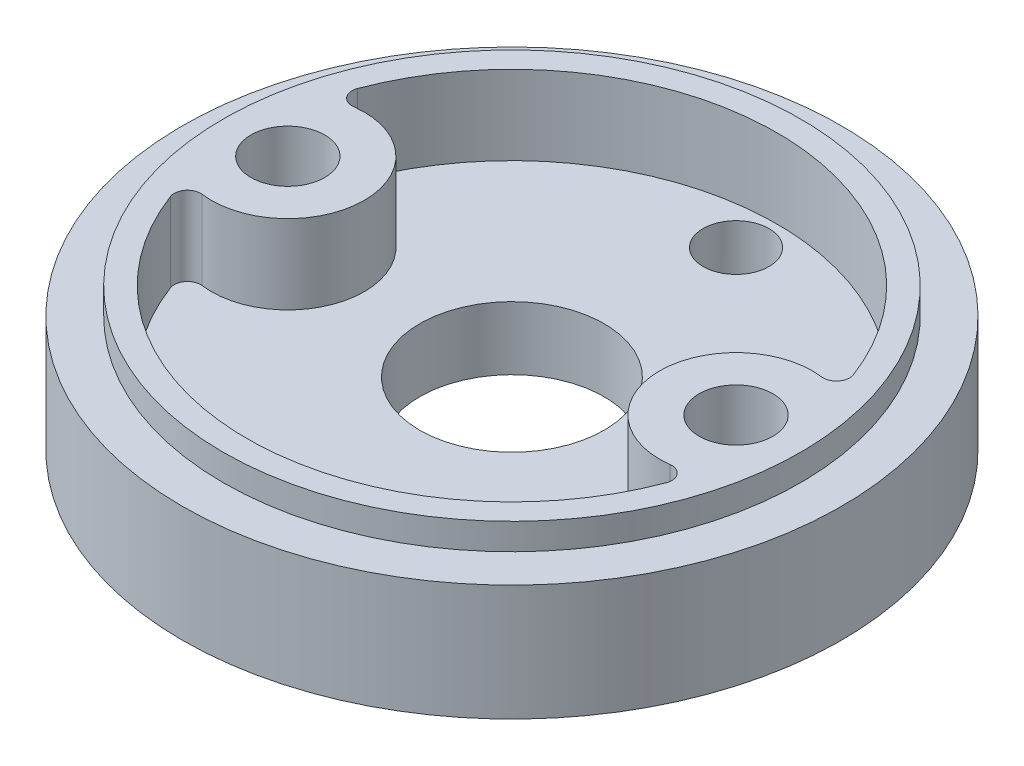
from build123d import *

# Parameters (mm, degrees)
SKETCH1_R             = 12.5
BOSS_EXTRUDE1_DEPTH   = 4.4
SKETCH2_R             = 10.95
BOSS_EXTRUDE2_DEPTH   = 1
SKETCH3_R             = 10.05
CUT_EXTRUDE1_DEPTH    = 3
SKETCH4_R             = 3.5
CUT_EXTRUDE2_DEPTH    = 18.930421077
SKETCH5_R             = 1.4
CUT_EXTRUDE3_DEPTH    = 19.484047176
SKETCH6_R             = 1.4
BOSS_EXTRUDE3_DEPTH   = 3
FILLET1_R             = 0.5
SKETCH7_R             = 2.5
CUT_EXTRUDE4_DEPTH    = 2.65
M3X0_5_TAPPED_HOLE1_D = 2.5


with BuildPart() as part:
    # Sketch1 → Boss-Extrude1 (new body)
    with BuildSketch(Plane(origin=(0, 0, 0), x_dir=(1, 0, 0), z_dir=(0, 1, 0))):
        with Locations(Location((0, 0, 0), (0, 0, 270))):
            Circle(SKETCH1_R)
    extrude(amount=BOSS_EXTRUDE1_DEPTH)

    # Sketch2 → Boss-Extrude2 (add)
    with BuildSketch(Plane(origin=(0, 4.4, 0), x_dir=(1, 0, 0), z_dir=(0, 1, 0))):
        with Locations(Location((0, 0, 0), (0, 0, 270))):
            Circle(SKETCH2_R)
    extrude(amount=BOSS_EXTRUDE2_DEPTH)

    # Sketch3 → Cut-Extrude1 (cut)
    with BuildSketch(Plane(origin=(0, 5.4, 0), x_dir=(1, 0, 0), z_dir=(0, 1, 0))):
        with Locations(Location((0, 0, 0), (0, 0, 270))):
            Circle(SKETCH3_R)
    extrude(amount=-CUT_EXTRUDE1_DEPTH, mode=Mode.SUBTRACT)

    # Sketch4 → Cut-Extrude2 (cut, through all)
    with BuildSketch(Plane(origin=(0, 2.4, 0), x_dir=(1, 0, 0), z_dir=(0, 1, 0))):
        with Locations(Location((0, 0, 0), (0, 0, 270))):
            Circle(SKETCH4_R)
    extrude(amount=-CUT_EXTRUDE2_DEPTH, mode=Mode.SUBTRACT)

    # Sketch5 → Cut-Extrude3 (cut, through all)
    with BuildSketch(Plane.XZ):
        with Locations(Location((-8.5, 0, 0), (0, 0, 270))):
            Circle(SKETCH5_R)
        with Locations(Location((8.5, 0, 0), (0, 0, 270))):
            Circle(SKETCH5_R)
    extrude(amount=-CUT_EXTRUDE3_DEPTH, mode=Mode.SUBTRACT)

    # Sketch6 → Boss-Extrude3 (add)
    # profile 1 of 2: a face of its own
    with BuildSketch(Plane(origin=(0, 2.4, 0), x_dir=(1, 0, 0), z_dir=(0, 1, 0))):
        with BuildLine():
            ThreePointArc((-9.696617647, 2.641610533), (-5.6, 0), (-9.696617647, -2.641610533))
            ThreePointArc((-9.696617647, -2.641610533), (-10.05, 0), (-9.696617647, 2.641610533))
        make_face()
        with Locations(Location((-8.5, 0, 0), (0, 0, 90))):
            Circle(SKETCH6_R, mode=Mode.SUBTRACT)
    # profile 2 of 2: a face of its own
    with BuildSketch(Plane(origin=(0, 2.4, 0), x_dir=(1, 0, 0), z_dir=(0, 1, 0))):
        with BuildLine():
            ThreePointArc((9.696617647, -2.641610533), (5.6, 0), (9.696617647, 2.641610533))
            ThreePointArc((9.696617647, 2.641610533), (10.05, 0), (9.696617647, -2.641610533))
        make_face()
        with Locations(Location((8.5, 0, 0), (0, 0, 90))):
            Circle(SKETCH6_R, mode=Mode.SUBTRACT)
    extrude(amount=BOSS_EXTRUDE3_DEPTH)

    # Fillet1
    # the kernel refuses this fillet: 0.5 mm, written as the material it adds along each edge
    with BuildSketch(Plane(origin=(-9.696617647, 0.016337815, 2.641610533), x_dir=(0.30831902274011397, 0, 0.9512830179376593), z_dir=(0, 1, 0)), Plane(origin=(9.696617647, 0.016337815, -2.641610533), x_dir=(-0.30831902274011413, 0, -0.9512830179376593), z_dir=(0, 1, 0))) as fillet1_piece_1:
        with BuildLine():
            CenterArc((0.929746842, 0.499437138), FILLET1_R, 154.693905627, 118.025000924)
            ThreePointArc((0.477728298, 0.713164151), (0.265396902, 0.338808542), (0, 0))
            ThreePointArc((0, 0), (0.476732437, -0.011313523), (0.953464874, 0))
        make_face()
    extrude(amount=5.383662185)
    with BuildSketch(Plane(origin=(-9.696617647, 0.016337815, -2.641610533), x_dir=(0.9619368896352812, 0, -0.2732716969589074), z_dir=(0, 1, 0)), Plane(origin=(9.696617647, 0.016337815, 2.641610533), x_dir=(-0.9619368896352809, 0, 0.2732716969589082), z_dir=(0, 1, 0))) as fillet1_piece_2:
        with BuildLine():
            CenterArc((0.932385368, 0.494493854), FILLET1_R, 143.464092257, 118.025000924)
            ThreePointArc((0.530643407, 0.792157081), (0.255922209, 0.402374993), (0, 0))
            ThreePointArc((0, 0), (0.429193265, 0.031935645), (0.858386529, 0))
        make_face()
    extrude(amount=5.383662185)

    # Sketch7 → Cut-Extrude4 (cut)
    with BuildSketch(Plane.XZ):
        with Locations(Location((-8.5, 0, 0), (0, 0, 270))):
            Circle(SKETCH7_R)
        with Locations(Location((8.5, 0, 0), (0, 0, 270))):
            Circle(SKETCH7_R)
    extrude(amount=-CUT_EXTRUDE4_DEPTH, mode=Mode.SUBTRACT)

    # M3x0.5 Tapped Hole1 (through all)
    with Locations(Plane(origin=(0, 0, 0), x_dir=(-1, 0, 0), z_dir=(0, -1, 0))):
        with Locations((0, 8.5), (0, -8.5)):
            Hole(M3X0_5_TAPPED_HOLE1_D / 2)


solid = part.part
